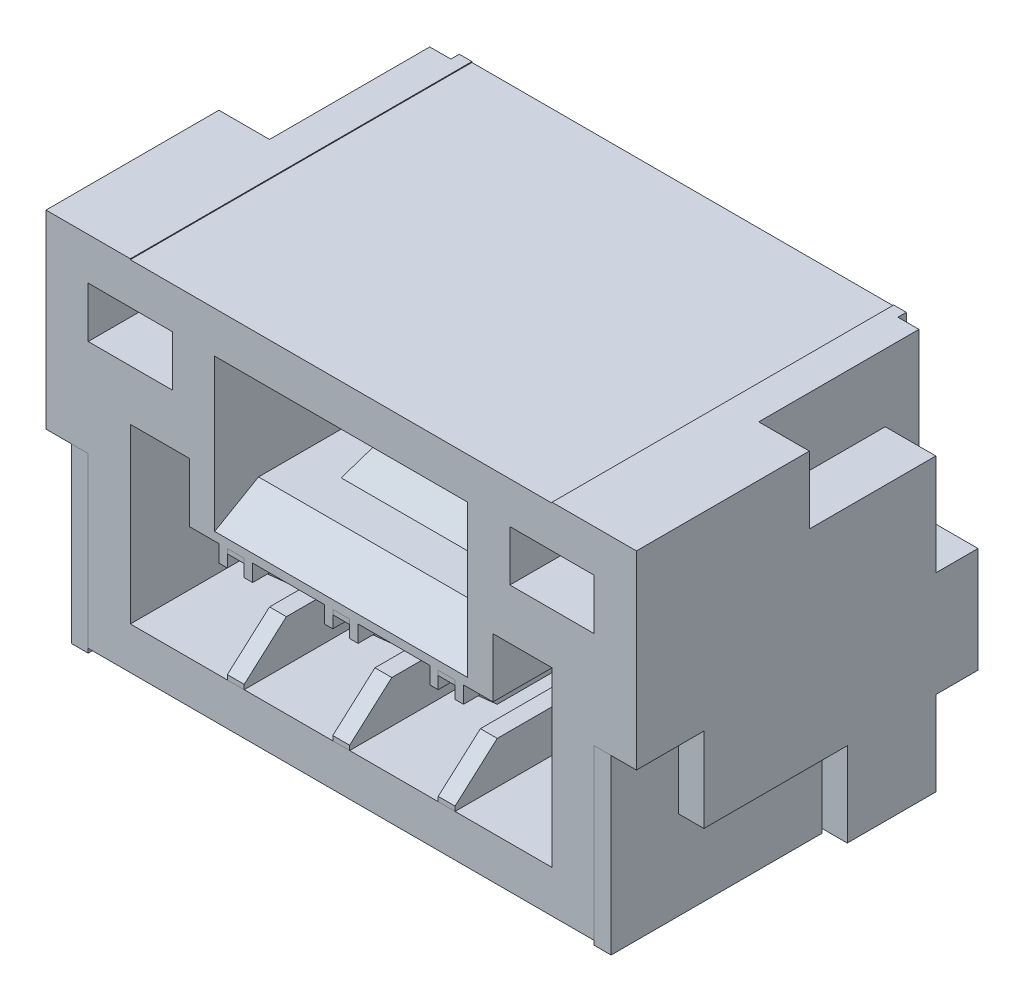
from build123d import *

# Parameters (mm, degrees)
B_SKETCH_W               = 7
B_SKETCH_H               = 4.05
B_BOSS_DEPTH             = 4.25
SKETCH3_W                = 3
SKETCH3_H                = 1.5
CUT_EXTRUDE2_DEPTH       = 7.834837233
SKETCH4_W                = 1
SKETCH4_H                = 0.6
CUT_EXTRUDE3_DEPTH       = 2
SKETCH5_W                = 5
SKETCH5_H                = 4.05
CUT_EXTRUDE4_DEPTH       = 0.01
CUT_EXTRUDE5_REACH       = 8.835
SKETCH6_W                = 0.5
SKETCH6_H                = 0.6
CUT_EXTRUDE6_DEPTH       = 0.6
SKETCH8_W                = 0.25
SKETCH8_H                = 2
CUT_EXTRUDE7_DEPTH       = 0.1
CHAMFER1_SIZE            = 0.3
CHAMFER1_SIZE2           = 0.519615242
BOSS_EXTRUDE2_DEPTH      = 1
BOSS_EXTRUDE2_DEPTH_BACK = 1
CUT_EXTRUDE8_DEPTH       = 0.5
BOSS_EXTRUDE3_DEPTH      = 0.2
CUT_EXTRUDE9_DEPTH       = 3.5
SKETCH14_W               = 0.1
SKETCH14_H               = 0.2
BOSS_EXTRUDE4_DEPTH      = 3.5
SKETCH17_W               = 7.625
SKETCH17_H               = 1
CUT_EXTRUDE11_DEPTH      = 0.5
SKETCH16_W               = 0.22
SKETCH16_H               = 0.85
CUT_EXTRUDE10_DEPTH      = 1
BOSS_EXTRUDE5_DEPTH      = 0.1
LPATTERN1_START          = -1.35
LPATTERN1_DEPTH          = 0.2
LPATTERN1_START_2        = -0.1
LPATTERN1_2_DEPTH        = 0.2
LPATTERN1_START_3        = -1.36
LPATTERN1_3_OUTLINE_W    = 0.85
LPATTERN1_3_OUTLINE_H    = 0.55
LPATTERN1_3_DEPTH        = 0.22
LPATTERN1_START_4        = -0.11
LPATTERN1_4_OUTLINE_W    = 0.85
LPATTERN1_4_OUTLINE_H    = 0.55
LPATTERN1_4_DEPTH        = 0.22
LPATTERN1_START_5        = -1.45
LPATTERN1_5_OUTLINE_W    = 0.2
LPATTERN1_5_OUTLINE_H    = 3.5
LPATTERN1_5_DEPTH        = 0.09
LPATTERN1_START_6        = -1.14
LPATTERN1_6_OUTLINE_W    = 0.2
LPATTERN1_6_OUTLINE_H    = 3.5
LPATTERN1_6_DEPTH        = 0.09
LPATTERN1_START_7        = -0.2
LPATTERN1_7_OUTLINE_W    = 0.2
LPATTERN1_7_OUTLINE_H    = 3.5
LPATTERN1_7_DEPTH        = 0.09
LPATTERN1_START_8        = 0.11
LPATTERN1_8_OUTLINE_W    = 0.2
LPATTERN1_8_OUTLINE_H    = 3.5
LPATTERN1_8_DEPTH        = 0.09
LPATTERN1_9_OUTLINE_W    = 0.2
LPATTERN1_9_OUTLINE_H    = 3.05
LPATTERN1_9_DEPTH        = 0.01
LPATTERN1_START_9        = -1.15
LPATTERN1_10_OUTLINE_W   = 0.2
LPATTERN1_10_OUTLINE_H   = 3.05
LPATTERN1_10_DEPTH       = 0.01
LPATTERN1_11_OUTLINE_W   = 0.2
LPATTERN1_11_OUTLINE_H   = 3.05
LPATTERN1_11_DEPTH       = 0.01
LPATTERN1_START_10       = 0.1
LPATTERN1_12_OUTLINE_W   = 0.2
LPATTERN1_12_OUTLINE_H   = 3.05
LPATTERN1_12_DEPTH       = 0.01


# Read off the part's stored shape, not the designer's step: LPattern1
with BuildPart() as part:
    # B Sketch → B Boss (new body)
    with BuildSketch(Plane(origin=(0, 0, 0), x_dir=(1, 0, 0), z_dir=(0, 1, 0))):
        Rectangle(B_SKETCH_W, B_SKETCH_H)
    extrude(amount=B_BOSS_DEPTH)

    # Sketch3 → Cut-Extrude2 (cut, through all)
    with BuildSketch(Plane.XY.offset(2.025)):
        with Locations((0, 3)):
            Rectangle(SKETCH3_W, SKETCH3_H)
    extrude(amount=-CUT_EXTRUDE2_DEPTH, mode=Mode.SUBTRACT)

    # Sketch4 → Cut-Extrude3 (cut)
    with BuildSketch(Plane.XY.offset(2.025)):
        with Locations((2.5, 3.45)):
            Rectangle(SKETCH4_W, SKETCH4_H)
        with Locations((-2.5, 3.45)):
            Rectangle(SKETCH4_W, SKETCH4_H)
    extrude(amount=-CUT_EXTRUDE3_DEPTH, mode=Mode.SUBTRACT)

    # Sketch5 → Cut-Extrude4 (cut)
    with BuildSketch(Plane(origin=(0, 4.25, 0), x_dir=(1, 0, 0), z_dir=(0, 1, 0))):
        Rectangle(SKETCH5_W, SKETCH5_H)
    extrude(amount=-CUT_EXTRUDE4_DEPTH, mode=Mode.SUBTRACT)

    # Sketch6 → Cut-Extrude5 (cut, up to next)
    with BuildSketch(Plane(origin=(0, 0, -2.025), x_dir=(-1, 0, 0), z_dir=(0, 0, -1)), mode=Mode.PRIVATE) as cut_extrude5_sk1:
        with Locations((2.25, 3.45)):
            Rectangle(SKETCH6_W, SKETCH6_H)
    cut_extrude5_tool1 = extrude(cut_extrude5_sk1.sketch, amount=-CUT_EXTRUDE5_REACH, mode=Mode.PRIVATE) & part.part
    # Sketch6 → Cut-Extrude5 (cut, up to next)
    with BuildSketch(Plane(origin=(0, 0, -2.025), x_dir=(-1, 0, 0), z_dir=(0, 0, -1)), mode=Mode.PRIVATE) as cut_extrude5_sk2:
        with Locations((-2.25, 3.45)):
            Rectangle(SKETCH6_W, SKETCH6_H)
    cut_extrude5_tool2 = extrude(cut_extrude5_sk2.sketch, amount=-CUT_EXTRUDE5_REACH, mode=Mode.PRIVATE) & part.part
    add(cut_extrude5_tool1.solids().sort_by_distance((-2.25, 3.45, -2.025))[0], mode=Mode.SUBTRACT)
    add(cut_extrude5_tool2.solids().sort_by_distance((2.25, 3.45, -2.025))[0], mode=Mode.SUBTRACT)

    # Sketch7 → Cut-Extrude6 (cut)
    with BuildSketch(Plane.ZY.offset(3.5)):
        Polygon((-0.025, 4.25), (-2.025, 4.25), (-2.025, 2.25), (-1.525, 2.25), (-1.525, 3.45), (-0.025, 3.45), align=None)
    cut_extrude6 = extrude(amount=-CUT_EXTRUDE6_DEPTH, mode=Mode.SUBTRACT)

    # Mirror1: Cut-Extrude6 across plane
    add(cut_extrude6.mirror(Plane(origin=(0, 0, 0), x_dir=(0, 0, 1), z_dir=(1, 0, 0))), mode=Mode.SUBTRACT)

    # Sketch8 → Cut-Extrude7 (cut)
    with BuildSketch(Plane(origin=(0, 0, -2.025), x_dir=(-1, 0, 0), z_dir=(0, 0, -1))):
        with Locations((2.775, 3.25)):
            Rectangle(SKETCH8_W, SKETCH8_H)
        with Locations((-2.775, 3.25)):
            Rectangle(SKETCH8_W, SKETCH8_H)
    extrude(amount=-CUT_EXTRUDE7_DEPTH, mode=Mode.SUBTRACT)

    # Chamfer1
    chamfer1_edges = [part.edges().sort_by_distance(p)[0] for p in [
        (0, 2.25, 2.025),
    ]]
    chamfer1_side = [part.faces().sort_by_distance(p)[0] for p in [
        (0, 1.890270833, 2.025),
    ]]
    chamfer(chamfer1_edges, length=CHAMFER1_SIZE, length2=CHAMFER1_SIZE2, reference=chamfer1_side[0])

    # Sketch10 → Boss-Extrude2 (add, two sides: drawn at the far end of the back side and taken through both)
    with BuildSketch(Plane(origin=(0, 0, 0), x_dir=(0, 0, -1), z_dir=(1, 0, 0)).offset(-BOSS_EXTRUDE2_DEPTH_BACK)):
        Polygon((-1.025, 2.25), (0.475, 2.75), (0.475, 2.25), align=None)
    extrude(amount=BOSS_EXTRUDE2_DEPTH + BOSS_EXTRUDE2_DEPTH_BACK)

    # Sketch11 → Cut-Extrude8 (cut)
    with BuildSketch(Plane(origin=(3.5, 0, 0), x_dir=(0, 0, -1), z_dir=(1, 0, 0))):
        Polygon((-2.025, 0), (-2.025, 2), (-1.225, 2), (-1.225, 1), (0.475, 1), (0.475, 0), align=None)
    cut_extrude8 = extrude(amount=-CUT_EXTRUDE8_DEPTH, mode=Mode.SUBTRACT)

    # Mirror4: Cut-Extrude8 across plane
    add(cut_extrude8.mirror(Plane(origin=(0, 0, 0), x_dir=(0, 0, 1), z_dir=(1, 0, 0))), mode=Mode.SUBTRACT)

    # Sketch13 → Cut-Extrude9 (cut)
    with BuildSketch(Plane.XY.offset(2.025)):
        Polygon((-1.8, 1.85), (1.8, 1.85), (1.8, 2.55), (2.5, 2.55), (2.5, 1.85), (2.5, 0.5), (-2.5, 0.5), (-2.5, 1.85), (-2.5, 2.55), (-1.8, 2.55), align=None)
    extrude(amount=-CUT_EXTRUDE9_DEPTH, mode=Mode.SUBTRACT)

    # Sketch14 → Boss-Extrude4 (add)
    with BuildSketch(Plane.XY.offset(2.025)):
        with Locations((1.4, 1.75)):
            Rectangle(SKETCH14_W, SKETCH14_H)
        with Locations((1.1, 1.75)):
            Rectangle(SKETCH14_W, SKETCH14_H)
    extrude(amount=-BOSS_EXTRUDE4_DEPTH)

    # Sketch17 → Cut-Extrude11 (cut)
    with BuildSketch(Plane(origin=(0, 0, -2.025), x_dir=(-1, 0, 0), z_dir=(0, 0, -1))):
        with Locations((0.3125, 0.5)):
            Rectangle(SKETCH17_W, SKETCH17_H)
    extrude(amount=-CUT_EXTRUDE11_DEPTH, mode=Mode.SUBTRACT)

    # Sketch16 → Cut-Extrude10 (cut)
    with BuildSketch(Plane(origin=(0, 0, -2.025), x_dir=(-1, 0, 0), z_dir=(0, 0, -1))):
        with Locations((-1.25, 1.425)):
            Rectangle(SKETCH16_W, SKETCH16_H)
    extrude(amount=-CUT_EXTRUDE10_DEPTH, mode=Mode.SUBTRACT)

    # LPattern1 3 outline → LPattern1 3 (cut)
    with BuildSketch(Plane.YZ.offset(LPATTERN1_START_3)):
        with Locations((1.425, -1.75)):
            Rectangle(LPATTERN1_3_OUTLINE_W, LPATTERN1_3_OUTLINE_H)
    extrude(amount=LPATTERN1_3_DEPTH, mode=Mode.SUBTRACT)

    # LPattern1 4 outline → LPattern1 4 (cut)
    with BuildSketch(Plane.YZ.offset(LPATTERN1_START_4)):
        with Locations((1.425, -1.75)):
            Rectangle(LPATTERN1_4_OUTLINE_W, LPATTERN1_4_OUTLINE_H)
    extrude(amount=LPATTERN1_4_DEPTH, mode=Mode.SUBTRACT)

    # LPattern1 5 outline → LPattern1 5 (add)
    with BuildSketch(Plane.YZ.offset(LPATTERN1_START_5)):
        with Locations((1.75, 0.275)):
            Rectangle(LPATTERN1_5_OUTLINE_W, LPATTERN1_5_OUTLINE_H)
    extrude(amount=LPATTERN1_5_DEPTH)

    # LPattern1 6 outline → LPattern1 6 (add)
    with BuildSketch(Plane.YZ.offset(LPATTERN1_START_6)):
        with Locations((1.75, 0.275)):
            Rectangle(LPATTERN1_6_OUTLINE_W, LPATTERN1_6_OUTLINE_H)
    extrude(amount=LPATTERN1_6_DEPTH)

    # LPattern1 7 outline → LPattern1 7 (add)
    with BuildSketch(Plane.YZ.offset(LPATTERN1_START_7)):
        with Locations((1.75, 0.275)):
            Rectangle(LPATTERN1_7_OUTLINE_W, LPATTERN1_7_OUTLINE_H)
    extrude(amount=LPATTERN1_7_DEPTH)

    # LPattern1 8 outline → LPattern1 8 (add)
    with BuildSketch(Plane.YZ.offset(LPATTERN1_START_8)):
        with Locations((1.75, 0.275)):
            Rectangle(LPATTERN1_8_OUTLINE_W, LPATTERN1_8_OUTLINE_H)
    extrude(amount=LPATTERN1_8_DEPTH)

    # LPattern1 9 outline → LPattern1 9 (add)
    with BuildSketch(Plane.YZ.offset(LPATTERN1_START_3)):
        with Locations((1.75, 0.5)):
            Rectangle(LPATTERN1_9_OUTLINE_W, LPATTERN1_9_OUTLINE_H)
    extrude(amount=LPATTERN1_9_DEPTH)

    # LPattern1 10 outline → LPattern1 10 (add)
    with BuildSketch(Plane.YZ.offset(LPATTERN1_START_9)):
        with Locations((1.75, 0.5)):
            Rectangle(LPATTERN1_10_OUTLINE_W, LPATTERN1_10_OUTLINE_H)
    extrude(amount=LPATTERN1_10_DEPTH)

    # LPattern1 11 outline → LPattern1 11 (add)
    with BuildSketch(Plane.YZ.offset(LPATTERN1_START_4)):
        with Locations((1.75, 0.5)):
            Rectangle(LPATTERN1_11_OUTLINE_W, LPATTERN1_11_OUTLINE_H)
    extrude(amount=LPATTERN1_11_DEPTH)

    # LPattern1 12 outline → LPattern1 12 (add)
    with BuildSketch(Plane.YZ.offset(LPATTERN1_START_10)):
        with Locations((1.75, 0.5)):
            Rectangle(LPATTERN1_12_OUTLINE_W, LPATTERN1_12_OUTLINE_H)
    extrude(amount=LPATTERN1_12_DEPTH)


with BuildPart() as body_2:
    # Sketch12 → Boss-Extrude3 (new body)
    with BuildSketch(Plane(origin=(3, 0, 0), x_dir=(0, 0, -1), z_dir=(1, 0, 0))):
        Polygon((-2.025, 0), (-2.025, -0.05), (0.475, -0.05), (0.475, 0), (0.475, 1), (-1.225, 1), (-1.225, 2), (-2.025, 2), align=None)
    extrude(amount=BOSS_EXTRUDE3_DEPTH)


with BuildPart() as body_3:
    # Mirror5: mirrored copy
    add(body_2.part.mirror(Plane(origin=(0, 0, 0), x_dir=(0, 0, 1), z_dir=(1, 0, 0))))


with BuildPart() as body_4:
    # Sketch18 → Boss-Extrude5 (new, symmetric)
    with BuildSketch(Plane(origin=(1.25, 0, 0), x_dir=(0, 0, -1), z_dir=(1, 0, 0))):
        with BuildLine():
            Line((-2.025, 1.85), (-2.025, 1.795247432))
            Line((-2.025, 1.795247432), (-1.525, 1.35))
            Line((-1.525, 1.35), (1.525, 1.35))
            Line((1.525, 1.35), (1.525, 1))
            Line((1.525, 1), (-1.525, 1))
            Line((-1.525, 1), (-2.025, 0.554752568))
            Line((-2.025, 0.554752568), (-2.025, 0.5))
            Line((-2.025, 0.5), (1.525, 0.5))
            Line((1.525, 0.5), (1.525, 0.25))
            ThreePointArc((1.525, 0.25), (1.612867966, 0.037867966), (1.825, -0.05))
            Line((1.825, -0.05), (2.825, -0.05))
            Line((2.825, -0.05), (2.825, 0.5))
            Line((2.825, 0.5), (2.325, 0.5))
            ThreePointArc((2.325, 0.5), (2.112867966, 0.587867966), (2.025, 0.8))
            Line((2.025, 0.8), (2.025, 1.85))
            Line((2.025, 1.85), (-2.025, 1.85))
        make_face()
    extrude(amount=BOSS_EXTRUDE5_DEPTH, both=True)


with BuildPart() as body_5:
    # LPattern1 outline → LPattern1 (new body)
    with BuildSketch(Plane.YZ.offset(LPATTERN1_START)):
        with BuildLine():
            Line((0.5, -2.825), (0.5, -2.325))
            ThreePointArc((0.5, -2.325), (0.587867966, -2.112867966), (0.8, -2.025))
            Line((0.8, -2.025), (1.85, -2.025))
            Line((1.85, -2.025), (1.85, 2.025))
            Line((1.85, 2.025), (1.795247432, 2.025))
            Line((1.795247432, 2.025), (1.35, 1.525))
            Line((1.35, 1.525), (1.35, -1.525))
            Line((1.35, -1.525), (1, -1.525))
            Line((1, -1.525), (1, 1.525))
            Line((1, 1.525), (0.554752568, 2.025))
            Line((0.554752568, 2.025), (0.5, 2.025))
            Line((0.5, 2.025), (0.5, -1.525))
            Line((0.5, -1.525), (0.25, -1.525))
            ThreePointArc((0.25, -1.525), (0.037867966, -1.612867966), (-0.05, -1.825))
            Line((-0.05, -1.825), (-0.05, -2.825))
            Line((-0.05, -2.825), (0.5, -2.825))
        make_face()
    extrude(amount=LPATTERN1_DEPTH)


with BuildPart() as body_6:
    # LPattern1 2 outline → LPattern1 2 (new body)
    with BuildSketch(Plane.YZ.offset(LPATTERN1_START_2)):
        with BuildLine():
            Line((0.5, -2.825), (0.5, -2.325))
            ThreePointArc((0.5, -2.325), (0.587867966, -2.112867966), (0.8, -2.025))
            Line((0.8, -2.025), (1.85, -2.025))
            Line((1.85, -2.025), (1.85, 2.025))
            Line((1.85, 2.025), (1.795247432, 2.025))
            Line((1.795247432, 2.025), (1.35, 1.525))
            Line((1.35, 1.525), (1.35, -1.525))
            Line((1.35, -1.525), (1, -1.525))
            Line((1, -1.525), (1, 1.525))
            Line((1, 1.525), (0.554752568, 2.025))
            Line((0.554752568, 2.025), (0.5, 2.025))
            Line((0.5, 2.025), (0.5, -1.525))
            Line((0.5, -1.525), (0.25, -1.525))
            ThreePointArc((0.25, -1.525), (0.037867966, -1.612867966), (-0.05, -1.825))
            Line((-0.05, -1.825), (-0.05, -2.825))
            Line((-0.05, -2.825), (0.5, -2.825))
        make_face()
    extrude(amount=LPATTERN1_2_DEPTH)


solid = Compound([part.part, body_2.part, body_3.part, body_4.part, body_5.part, body_6.part])
